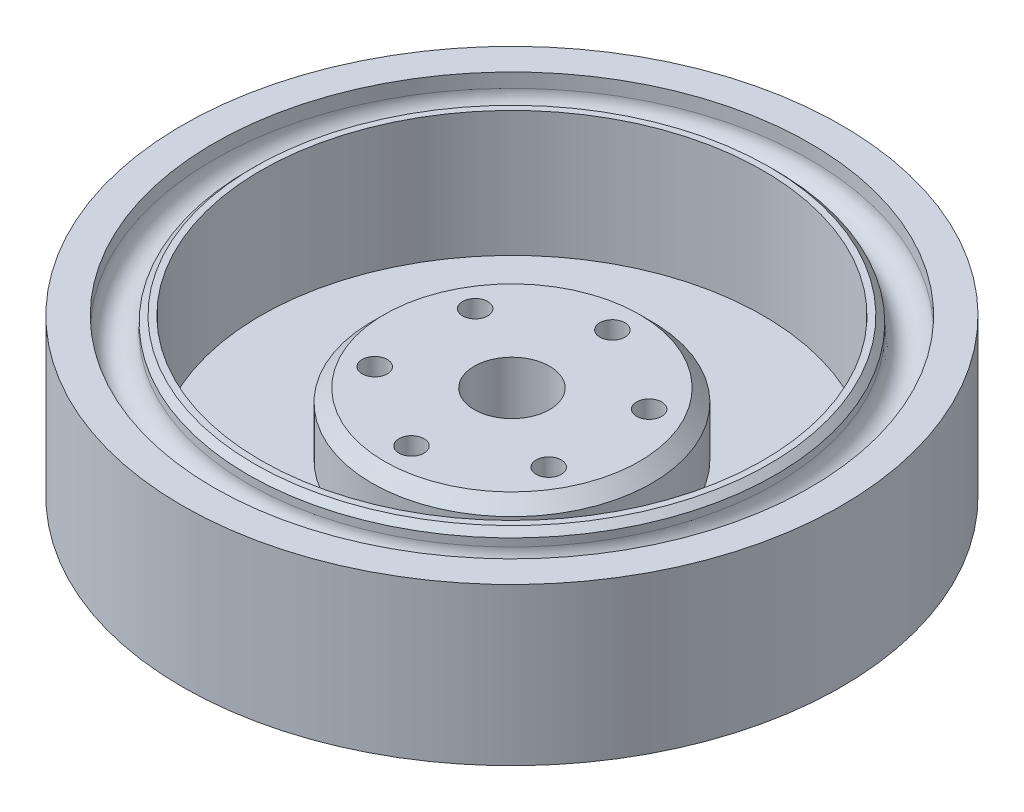
from build123d import *

# Parameters (mm, degrees)
ESQUISSE1_R             = 52.5
BOSS_EXTRU_1_DEPTH      = 25
ESQUISSE2_R             = 40
ENL_V_MAT_EXTRU_1_DEPTH = 20
ESQUISSE3_R             = 22.3
BOSS_EXTRU_2_DEPTH      = 10
CHANFREIN1_SIZE         = 2
ENL_V_MAT_EXTRU_2_REACH = 77.746
ESQUISSE4_R             = 2
ESQUISSE4_R_2           = 6
ESQUISSE5_R             = 47.5
ESQUISSE5_R_2           = 42
ENL_V_MAT_EXTRU_3_DEPTH = 5
CONG_2_R                = 2.75
CHANFREIN2_SIZE         = 1
ESQUISSE6_R             = 5
ENL_V_MAT_EXTRU_4_DEPTH = 5


with BuildPart() as part:
    # Esquisse1 → Boss.-Extru.1 (new body)
    with BuildSketch(Plane(origin=(0, 0, 0), x_dir=(1, 0, 0), z_dir=(0, 1, 0))):
        with Locations(Location((0, 0, 0), (0, 0, 270))):
            Circle(ESQUISSE1_R)
    extrude(amount=BOSS_EXTRU_1_DEPTH)

    # Esquisse2 → Enlèv. mat.-Extru.1 (cut)
    with BuildSketch(Plane(origin=(0, 25, 0), x_dir=(1, 0, 0), z_dir=(0, 1, 0))):
        with Locations(Location((0, 0, 0), (0, 0, 270))):
            Circle(ESQUISSE2_R)
    extrude(amount=-ENL_V_MAT_EXTRU_1_DEPTH, mode=Mode.SUBTRACT)

    # Esquisse3 → Boss.-Extru.2 (add)
    with BuildSketch(Plane(origin=(0, 5, 0), x_dir=(1, 0, 0), z_dir=(0, 1, 0))):
        with Locations(Location((0, 0, 0), (0, 0, 270))):
            Circle(ESQUISSE3_R)
    extrude(amount=BOSS_EXTRU_2_DEPTH)

    # Chanfrein1
    chanfrein1_edges = [part.edges().sort_by_distance(p)[0] for p in [
        (0, 15, -22.3),
    ]]
    chamfer(chanfrein1_edges, length=CHANFREIN1_SIZE)

    # Esquisse4 → Enlèv. mat.-Extru.2 (cut, up to next)
    with BuildSketch(Plane(origin=(0, 15, 0), x_dir=(1, 0, 0), z_dir=(0, 1, 0)), mode=Mode.PRIVATE) as enl_v_mat_extru_2_sk1:
        with Locations(Location((0, 16, 0), (0, 0, 270))):
            Circle(ESQUISSE4_R)
    enl_v_mat_extru_2_tool1 = extrude(enl_v_mat_extru_2_sk1.sketch, amount=-ENL_V_MAT_EXTRU_2_REACH, mode=Mode.PRIVATE) & part.part
    # Esquisse4 → Enlèv. mat.-Extru.2 (cut, up to next)
    with BuildSketch(Plane(origin=(0, 15, 0), x_dir=(1, 0, 0), z_dir=(0, 1, 0)), mode=Mode.PRIVATE) as enl_v_mat_extru_2_sk2:
        with Locations(Location((13.856406461, 8, 0), (0, 0, 270))):
            Circle(ESQUISSE4_R)
    enl_v_mat_extru_2_tool2 = extrude(enl_v_mat_extru_2_sk2.sketch, amount=-ENL_V_MAT_EXTRU_2_REACH, mode=Mode.PRIVATE) & part.part
    # Esquisse4 → Enlèv. mat.-Extru.2 (cut, up to next)
    with BuildSketch(Plane(origin=(0, 15, 0), x_dir=(1, 0, 0), z_dir=(0, 1, 0)), mode=Mode.PRIVATE) as enl_v_mat_extru_2_sk3:
        with Locations(Location((13.856406461, -8, 0), (0, 0, 270))):
            Circle(ESQUISSE4_R)
    enl_v_mat_extru_2_tool3 = extrude(enl_v_mat_extru_2_sk3.sketch, amount=-ENL_V_MAT_EXTRU_2_REACH, mode=Mode.PRIVATE) & part.part
    # Esquisse4 → Enlèv. mat.-Extru.2 (cut, up to next)
    with BuildSketch(Plane(origin=(0, 15, 0), x_dir=(1, 0, 0), z_dir=(0, 1, 0)), mode=Mode.PRIVATE) as enl_v_mat_extru_2_sk4:
        with Locations(Location((0, -16, 0), (0, 0, 270))):
            Circle(ESQUISSE4_R)
    enl_v_mat_extru_2_tool4 = extrude(enl_v_mat_extru_2_sk4.sketch, amount=-ENL_V_MAT_EXTRU_2_REACH, mode=Mode.PRIVATE) & part.part
    # Esquisse4 → Enlèv. mat.-Extru.2 (cut, up to next)
    with BuildSketch(Plane(origin=(0, 15, 0), x_dir=(1, 0, 0), z_dir=(0, 1, 0)), mode=Mode.PRIVATE) as enl_v_mat_extru_2_sk5:
        with Locations(Location((-13.856406461, -8, 0), (0, 0, 270))):
            Circle(ESQUISSE4_R)
    enl_v_mat_extru_2_tool5 = extrude(enl_v_mat_extru_2_sk5.sketch, amount=-ENL_V_MAT_EXTRU_2_REACH, mode=Mode.PRIVATE) & part.part
    # Esquisse4 → Enlèv. mat.-Extru.2 (cut, up to next)
    with BuildSketch(Plane(origin=(0, 15, 0), x_dir=(1, 0, 0), z_dir=(0, 1, 0)), mode=Mode.PRIVATE) as enl_v_mat_extru_2_sk6:
        with Locations(Location((-13.856406461, 8, 0), (0, 0, 270))):
            Circle(ESQUISSE4_R)
    enl_v_mat_extru_2_tool6 = extrude(enl_v_mat_extru_2_sk6.sketch, amount=-ENL_V_MAT_EXTRU_2_REACH, mode=Mode.PRIVATE) & part.part
    # Esquisse4 → Enlèv. mat.-Extru.2 (cut, up to next)
    with BuildSketch(Plane(origin=(0, 15, 0), x_dir=(1, 0, 0), z_dir=(0, 1, 0)), mode=Mode.PRIVATE) as enl_v_mat_extru_2_sk7:
        with Locations(Location((0, 0, 0), (0, 0, 270))):
            Circle(ESQUISSE4_R_2)
    enl_v_mat_extru_2_tool7 = extrude(enl_v_mat_extru_2_sk7.sketch, amount=-ENL_V_MAT_EXTRU_2_REACH, mode=Mode.PRIVATE) & part.part
    add(enl_v_mat_extru_2_tool1.solids().sort_by_distance((0, 15, -16))[0], mode=Mode.SUBTRACT)
    add(enl_v_mat_extru_2_tool2.solids().sort_by_distance((13.856406, 15, -8))[0], mode=Mode.SUBTRACT)
    add(enl_v_mat_extru_2_tool3.solids().sort_by_distance((13.856406, 15, 8))[0], mode=Mode.SUBTRACT)
    add(enl_v_mat_extru_2_tool4.solids().sort_by_distance((0, 15, 16))[0], mode=Mode.SUBTRACT)
    add(enl_v_mat_extru_2_tool5.solids().sort_by_distance((-13.856406, 15, 8))[0], mode=Mode.SUBTRACT)
    add(enl_v_mat_extru_2_tool6.solids().sort_by_distance((-13.856406, 15, -8))[0], mode=Mode.SUBTRACT)
    add(enl_v_mat_extru_2_tool7.solids().sort_by_distance((0, 15, 0))[0], mode=Mode.SUBTRACT)

    # Esquisse5 → Enlèv. mat.-Extru.3 (cut)
    with BuildSketch(Plane(origin=(0, 25, 0), x_dir=(1, 0, 0), z_dir=(0, 1, 0))):
        with Locations(Location((0, 0, 0), (0, 0, 270))):
            Circle(ESQUISSE5_R)
        with Locations(Location((0, 0, 0), (0, 0, 270))):
            Circle(ESQUISSE5_R_2, mode=Mode.SUBTRACT)
    extrude(amount=-ENL_V_MAT_EXTRU_3_DEPTH, mode=Mode.SUBTRACT)

    # Congé2
    cong_2_edges = [part.edges().sort_by_distance(p)[0] for p in [
        (0, 20, -47.5),
        (0, 20, -42),
    ]]
    fillet(cong_2_edges, radius=CONG_2_R - 0.0001)  # a hair under: the kernel refuses the full size

    # Chanfrein2
    chanfrein2_edges = [part.edges().sort_by_distance(p)[0] for p in [
        (0, 25, -42),
    ]]
    chamfer(chanfrein2_edges, length=CHANFREIN2_SIZE)

    # Esquisse6 → Enlèv. mat.-Extru.4 (cut)
    with BuildSketch(Plane.XZ):
        with Locations(Location((0, 16, 0), (0, 0, 270))):
            Circle(ESQUISSE6_R)
        with Locations(Location((13.856406461, 8, 0), (0, 0, 270))):
            Circle(ESQUISSE6_R)
        with Locations(Location((13.856406461, -8, 0), (0, 0, 270))):
            Circle(ESQUISSE6_R)
        with Locations(Location((0, -16, 0), (0, 0, 270))):
            Circle(ESQUISSE6_R)
        with Locations(Location((-13.856406461, -8, 0), (0, 0, 270))):
            Circle(ESQUISSE6_R)
        with Locations(Location((-13.856406461, 8, 0), (0, 0, 270))):
            Circle(ESQUISSE6_R)
    extrude(amount=-ENL_V_MAT_EXTRU_4_DEPTH, mode=Mode.SUBTRACT)


solid = part.part
